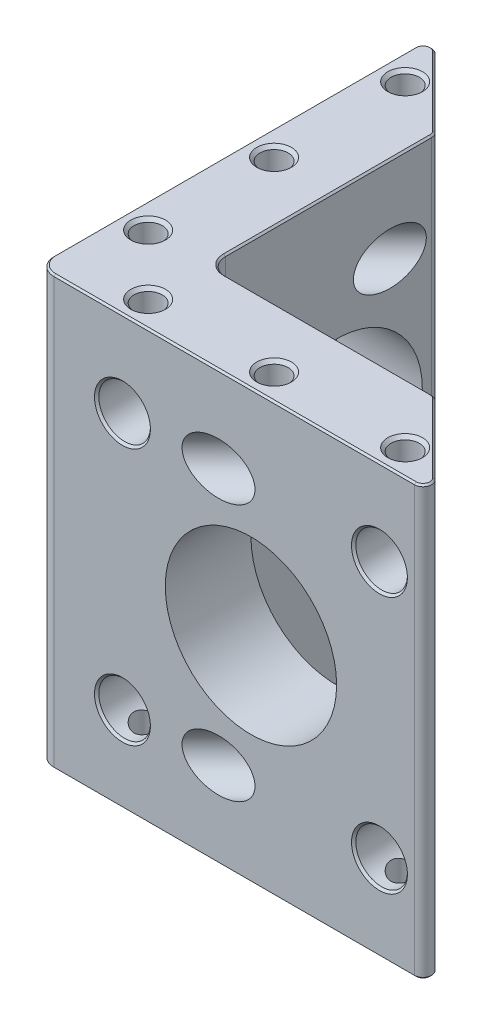
from build123d import *

# Parameters (mm, degrees)
EXTRUDE_2_DEPTH              = 50
SKETCH_7_R                   = 10
CUT_EXTRUDE_3_DEPTH          = 50
SKETCH_8_R                   = 10
CUT_EXTRUDE_4_DEPTH          = 10
HOLE_WIZARD_12_1_D           = 6.0198
HOLE_WIZARD_12_1_DEPTH       = 6.5
HOLE_WIZARD_12_1_CSINK_D     = 6.5278
HOLE_WIZARD_12_1_CSINK_ANGLE = 90
HOLE_WIZARD_12_2_D           = 6.0198
HOLE_WIZARD_12_2_DEPTH       = 6.5
HOLE_WIZARD_12_2_CSINK_D     = 6.5278
HOLE_WIZARD_12_2_CSINK_ANGLE = 90
PATTERN_LINEAR_2_COUNT       = 2
PATTERN_LINEAR_2_PITCH       = 30
PATTERN_LINEAR_2_COUNT_DIR2  = 2
PATTERN_LINEAR_2_PITCH_DIR2  = 30
PATTERN_LINEAR_3_COUNT       = 2
PATTERN_LINEAR_3_PITCH       = 30
PATTERN_LINEAR_3_COUNT_DIR2  = 2
PATTERN_LINEAR_3_PITCH_DIR2  = 30
PATTERN_LINEAR_4_COUNT       = 2
PATTERN_LINEAR_4_PITCH       = 30
PATTERN_LINEAR_5_COUNT       = 2
PATTERN_LINEAR_5_PITCH       = 30
CUT_EXTRUDE_6_DEPTH          = 87.602540378
CUT_EXTRUDE_7_DEPTH          = 85.630077396
HOLE_WIZARD_12_3_D           = 6.0198
HOLE_WIZARD_12_3_CSINK_D     = 6.5278
HOLE_WIZARD_12_3_CSINK_ANGLE = 90
FILLET_2_R                   = 1
FILLET_3_R                   = 2
CHAMFER_1_SIZE               = 0.2


# Read off the part's stored shape, not the designer's step: M4 螺纹孔3, M4 螺纹孔2, 阵列(线性)6, 阵列(线性)7
with BuildPart() as part:
    # 草图6 → 凸台-拉伸2 (new body)
    with BuildSketch(Plane(origin=(0, 0, 0), x_dir=(1, 0, 0), z_dir=(0, 1, 0))):
        Polygon((0, 0), (50, 0), (50, 10), (10, 10), (10, 50), (0, 50), align=None)
    extrude(amount=EXTRUDE_2_DEPTH)

    # 草图7 → 切除-拉伸3 (cut)
    with BuildSketch(Plane.XY):
        with Locations((25, 25)):
            Circle(SKETCH_7_R)
    extrude(amount=-CUT_EXTRUDE_3_DEPTH, mode=Mode.SUBTRACT)

    # 草图8 → 切除-拉伸4 (cut)
    with BuildSketch(Plane.ZY):
        with Locations((-25, 25)):
            Circle(SKETCH_8_R)
    extrude(amount=-CUT_EXTRUDE_4_DEPTH, mode=Mode.SUBTRACT)

    # #12 平头机械螺钉的锥形沉头孔1
    with Locations(Plane.XY):
        with Locations((10, 40)):
            hole_wizard_12_1 = CounterSinkHole(HOLE_WIZARD_12_1_D / 2, HOLE_WIZARD_12_1_CSINK_D / 2, depth=HOLE_WIZARD_12_1_DEPTH, counter_sink_angle=HOLE_WIZARD_12_1_CSINK_ANGLE)

    # #12 平头机械螺钉的锥形沉头孔2
    with Locations(Plane.ZY):
        with Locations((-10, 40)):
            hole_wizard_12_2 = CounterSinkHole(HOLE_WIZARD_12_2_D / 2, HOLE_WIZARD_12_2_CSINK_D / 2, depth=HOLE_WIZARD_12_2_DEPTH, counter_sink_angle=HOLE_WIZARD_12_2_CSINK_ANGLE)

    # 阵列(线性)2: Hole Wizard 12 _1 2 × 2
    with Locations(*[(i * PATTERN_LINEAR_2_PITCH, -j * PATTERN_LINEAR_2_PITCH_DIR2, 0) for i in range(PATTERN_LINEAR_2_COUNT) for j in range(PATTERN_LINEAR_2_COUNT_DIR2) if (i, j) != (0, 0)]):
        add(hole_wizard_12_1, mode=Mode.SUBTRACT)

    # 阵列(线性)3: Hole Wizard 12 _2 2 × 2
    with Locations(*[(0, -j * PATTERN_LINEAR_3_PITCH_DIR2, -i * PATTERN_LINEAR_3_PITCH) for i in range(PATTERN_LINEAR_3_COUNT) for j in range(PATTERN_LINEAR_3_COUNT_DIR2) if (i, j) != (0, 0)]):
        add(hole_wizard_12_2, mode=Mode.SUBTRACT)

    # M4 螺纹孔3 outline → M4 螺纹孔3 (revolve, cut)
    with BuildSketch(Plane(origin=(10, 0, -3), x_dir=(1, 0, 0), z_dir=(0, 0, 1))):
        Polygon((0, 42.517115997), (1.65, 42.517115997), (1.65, 49.625), (2.025, 50), (0, 50), align=None)
    hole_wizard_m4_3 = revolve(axis=Axis((10, 0, -3), (0, 1, 0)), mode=Mode.SUBTRACT)

    # 阵列(线性)4: M4 螺纹孔3 ×2
    with Locations(*[(i * PATTERN_LINEAR_4_PITCH, 0, 0) for i in range(1, PATTERN_LINEAR_4_COUNT)]):
        add(hole_wizard_m4_3, mode=Mode.SUBTRACT)

    # M4 螺纹孔2 outline → M4 螺纹孔2 (revolve, cut)
    with BuildSketch(Plane(origin=(3, 0, -10), x_dir=(1, 0, 0), z_dir=(0, 0, 1))):
        Polygon((0, 42.517123988), (1.65, 42.517123988), (1.65, 49.625), (2.025, 50), (0, 50), align=None)
    hole_wizard_m4_2 = revolve(axis=Axis((3, 0, -10), (0, 1, 0)), mode=Mode.SUBTRACT)

    # 阵列(线性)5: M4 螺纹孔2 ×2
    with Locations(*[(0, 0, -i * PATTERN_LINEAR_5_PITCH) for i in range(1, PATTERN_LINEAR_5_COUNT)]):
        add(hole_wizard_m4_2, mode=Mode.SUBTRACT)

    # 草图19 → 切除-拉伸6 (cut, through all)
    with BuildSketch(Plane(origin=(0, 50, 0), x_dir=(1, 0, 0), z_dir=(0, 1, 0))):
        Polygon((0, 46.5), (0, 50), (10, 50), (10, 36.5), align=None)
    extrude(amount=-CUT_EXTRUDE_6_DEPTH, mode=Mode.SUBTRACT)

    # 草图21 → 切除-拉伸7 (cut, through all)
    with BuildSketch(Plane(origin=(0, 50, 0), x_dir=(1, 0, 0), z_dir=(0, 1, 0))):
        Polygon((46.5, 0), (50, 0), (50, 10), (36.5, 10), align=None)
    extrude(amount=-CUT_EXTRUDE_7_DEPTH, mode=Mode.SUBTRACT)

    # #12 平头机械螺钉的锥形沉头孔3 (through all)
    with Locations(Plane(origin=(30, 0, -30), x_dir=(0.7071067811865476, 0, 0.7071067811865475), z_dir=(0.7071067811865475, 0, -0.7071067811865476))):
        with Locations((-15, -40), (15, -40), (-15, -10), (15, -10)):
            CounterSinkHole(HOLE_WIZARD_12_3_D / 2, HOLE_WIZARD_12_3_CSINK_D / 2, counter_sink_angle=HOLE_WIZARD_12_3_CSINK_ANGLE)

    # 圆角2
    fillet_2_edges = [part.edges().sort_by_distance(p)[0] for p in [
        (10, 25, -36.5),
        (0, 25, -46.5),
        (46.5, 25, 0),
        (36.5, 25, -10),
    ]]
    fillet(fillet_2_edges, radius=FILLET_2_R)

    # 圆角3
    fillet_3_edges = [part.edges().sort_by_distance(p)[0] for p in [
        (10, 25, -10),
        (0, 25, 0),
    ]]
    fillet(fillet_3_edges, radius=FILLET_3_R)

    # 倒角1
    chamfer_1_edges = [part.edges().sort_by_distance(p)[0] for p in [
        (40.792893219, 50, -5.707106781),
        (24.042893219, 50, -10),
        (5.707106781, 50, -40.792893219),
        (0, 50, -23.042893219),
        (0.617316568, 50, -45.00966597),
        (45.00966597, 50, -0.617316568),
        (36.46846987, 50, -9.923879533),
        (9.923879533, 50, -36.46846987),
        (5.707106781, 0, -40.792893219),
        (24.042893219, 0, -10),
        (40.792893219, 0, -5.707106781),
        (0, 0, -23.042893219),
        (0.617316568, 0, -45.00966597),
        (45.00966597, 0, -0.617316568),
        (36.46846987, 0, -9.923879533),
        (9.923879533, 0, -36.46846987),
        (10, 0, -24.042893219),
        (10, 50, -24.042893219),
        (23.042893219, 0, 0),
        (23.042893219, 50, 0),
        (0.585786438, 0, -0.585786438),
        (0.585786438, 50, -0.585786438),
        (10.585786438, 0, -10.585786438),
        (10.585786438, 50, -10.585786438),
    ]]
    chamfer(chamfer_1_edges, length=CHAMFER_1_SIZE)

    # 阵列(线性)6 outline → 阵列(线性)6 (revolve, cut)
    with BuildSketch(Plane(origin=(3, 0, -24.7), x_dir=(1, 0, 0), z_dir=(0, 0, 1))):
        Polygon((0, 42.254249638), (1.65, 42.254249638), (1.65, 49.625), (2.025, 50), (0, 50), align=None)
    pattern_linear_6 = revolve(axis=Axis((3, 0, -24.7), (0, 1, 0)), mode=Mode.SUBTRACT)

    # 阵列(线性)7 outline → 阵列(线性)7 (revolve, cut)
    with BuildSketch(Plane(origin=(24.7, 0, -3), x_dir=(1, 0, 0), z_dir=(0, 0, 1))):
        Polygon((0, 42.254238705), (1.65, 42.254238705), (1.65, 49.625), (2.025, 50), (0, 50), align=None)
    pattern_linear_7 = revolve(axis=Axis((24.7, 0, -3), (0, 1, 0)), mode=Mode.SUBTRACT)

    # 镜向1: M4 螺纹孔3, M4 螺纹孔2, 阵列(线性)6, 阵列(线性)7 across plane
    add(hole_wizard_m4_3.mirror(Plane.ZX.offset(25)), mode=Mode.SUBTRACT)
    add(hole_wizard_m4_2.mirror(Plane.ZX.offset(25)), mode=Mode.SUBTRACT)
    add(pattern_linear_6.mirror(Plane.ZX.offset(25)), mode=Mode.SUBTRACT)
    add(pattern_linear_7.mirror(Plane.ZX.offset(25)), mode=Mode.SUBTRACT)

    # 镜向1 copy 1 sketch → 镜向1 copy 1 (revolve, cut)
    with BuildSketch(Plane(origin=(40, 50, -3), x_dir=(1, 0, 0), z_dir=(0, 0, 1))):
        Polygon((0, -42.517115997), (1.65, -42.517115997), (1.65, -49.625), (2.025, -50), (0, -50), align=None)
    revolve(axis=Axis((40, 50, -3), (0, 1, 0)), mode=Mode.SUBTRACT)

    # 镜向1 copy 2 sketch → 镜向1 copy 2 (revolve, cut)
    with BuildSketch(Plane(origin=(3, 50, -40), x_dir=(1, 0, 0), z_dir=(0, 0, 1))):
        Polygon((0, -42.517123988), (1.65, -42.517123988), (1.65, -49.625), (2.025, -50), (0, -50), align=None)
    revolve(axis=Axis((3, 50, -40), (0, 1, 0)), mode=Mode.SUBTRACT)


solid = part.part
